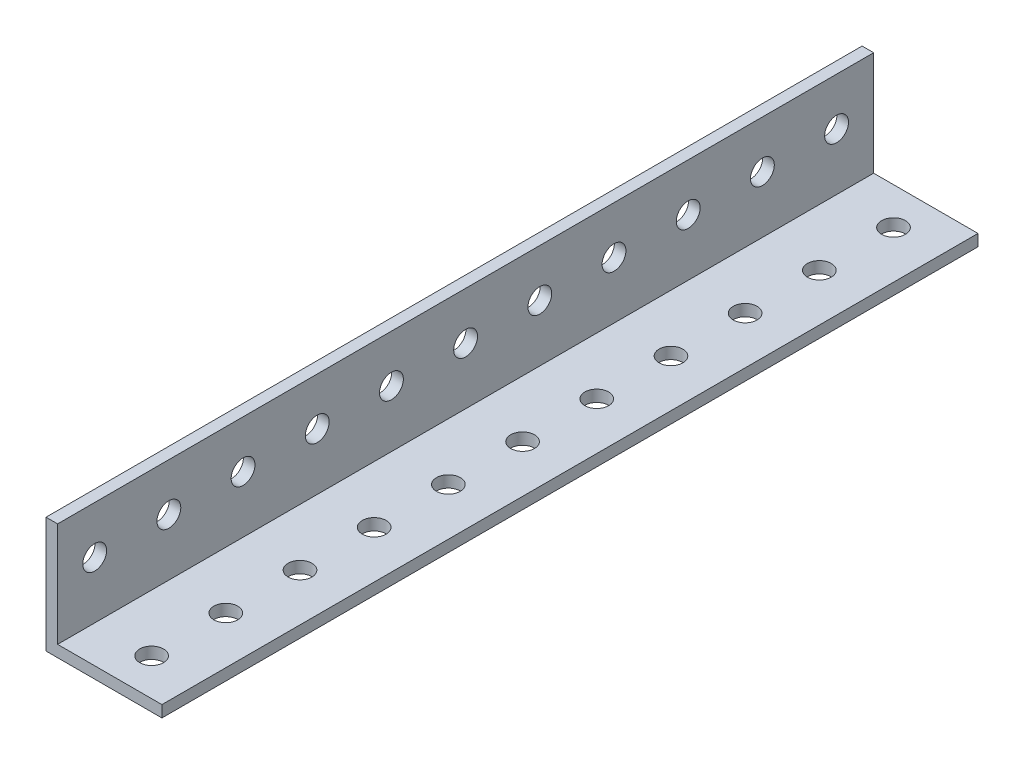
from build123d import *

# Parameters (mm, degrees)
EXTRUDE1_DEPTH       = 111.76
LPATTERN1_COUNT      = 6
LPATTERN1_PITCH      = 10.16
LPATTERN1_COUNT_DIR2 = 6
LPATTERN1_PITCH_DIR2 = 10.16
LPATTERN2_COUNT      = 6
LPATTERN2_PITCH      = 10.16
LPATTERN2_COUNT_DIR2 = 6
LPATTERN2_PITCH_DIR2 = 10.16


with BuildPart() as part:
    # Sketch1 → Extrude1 (new body)
    with BuildSketch(Plane.XY):
        Polygon((0, 0), (0, 15.875), (1.5875, 15.875), (1.5875, 1.5875), (15.875, 1.5875), (15.875, 0), align=None)
    extrude(amount=EXTRUDE1_DEPTH)

    # Sketch3 → #4 Clearance Hole1 (revolve, cut)
    with BuildSketch(Plane(origin=(9.3853, 1.5875, 55.88), x_dir=(0, 0, 1), z_dir=(1, 0, 0))):
        Polygon((0, 0), (0, 16.220574487), (1.63195, 15.24), (1.63195, 0), align=None)
    f_4_clearance_hole1 = revolve(axis=Axis((9.3853, 7.9375, 55.88), (0, -1, 0)), mode=Mode.SUBTRACT)

    # LPattern1: 4 Clearance Hole1 6 × 6
    with Locations(*[Vector(0, 0, 1) * (i * LPATTERN1_PITCH) + Vector(0, 0, -1) * (j * LPATTERN1_PITCH_DIR2) for i in range(LPATTERN1_COUNT) for j in range(LPATTERN1_COUNT_DIR2) if (i, j) != (0, 0)]):
        add(f_4_clearance_hole1, mode=Mode.SUBTRACT)

    # Sketch5 → #4 Clearance Hole2 (revolve, cut)
    with BuildSketch(Plane(origin=(1.5875, 9.3726, 55.88), x_dir=(0, 0, -1), z_dir=(0, 1, 0))):
        Polygon((0, 0), (0, 16.220574487), (1.63195, 15.24), (1.63195, 0), align=None)
    f_4_clearance_hole2 = revolve(axis=Axis((7.9375, 9.3726, 55.88), (-1, 0, 0)), mode=Mode.SUBTRACT)

    # LPattern2: 4 Clearance Hole2 6 × 6
    with Locations(*[Vector(0, 0, 1) * (i * LPATTERN2_PITCH) + Vector(0, 0, -1) * (j * LPATTERN2_PITCH_DIR2) for i in range(LPATTERN2_COUNT) for j in range(LPATTERN2_COUNT_DIR2) if (i, j) != (0, 0)]):
        add(f_4_clearance_hole2, mode=Mode.SUBTRACT)


solid = part.part
